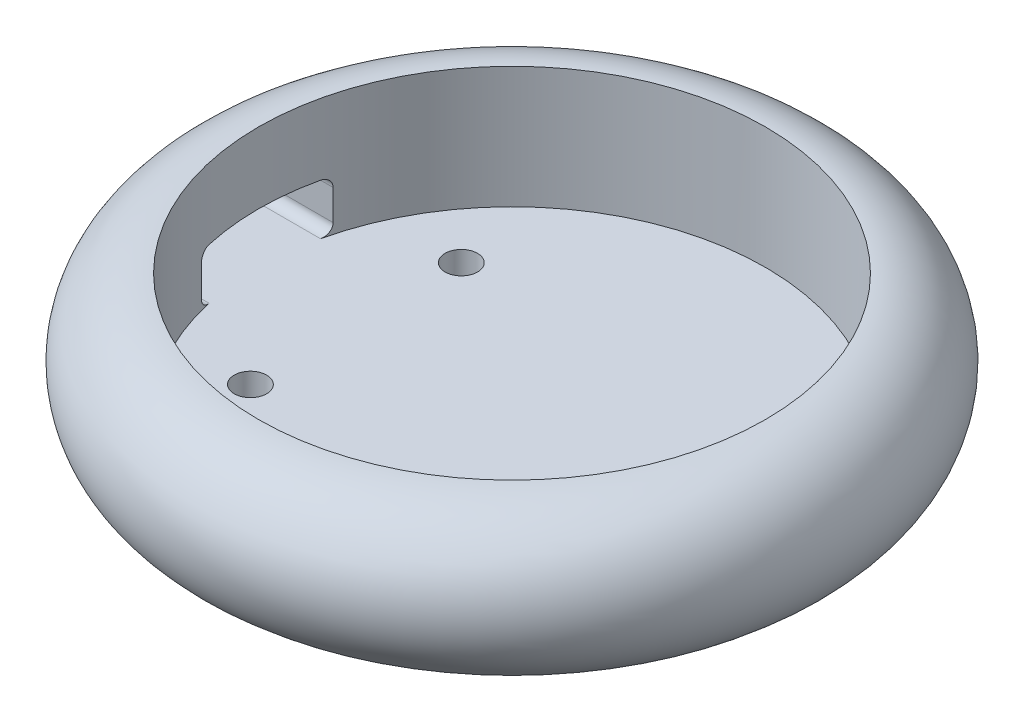
from build123d import *

# Parameters (mm, degrees)
SKETCH3_R          = 25
CUT_EXTRUDE2_DEPTH = 12
SKETCH4_R          = 1.6
CUT_EXTRUDE3_DEPTH = 6
SKETCH5_R          = 1.5
CUT_EXTRUDE4_DEPTH = 1
CUT_EXTRUDE6_DEPTH = 48.174881361


with BuildPart() as part:
    # Sketch1 → Revolve1 (revolve)
    with BuildSketch(Plane.XY):
        with BuildLine():
            Line((0, -4.371292721), (0, 10.628707279))
            Line((0, 10.628707279), (-25, 10.628707279))
            ThreePointArc((-25, 10.628707279), (-32.5, 3.128707279), (-25, -4.371292721))
            Line((-25, -4.371292721), (0, -4.371292721))
        make_face()
    revolve(axis=Axis((0, -4.371292721, 0), (0, 1, 0)))

    # Sketch3 → Cut-Extrude2 (cut)
    with BuildSketch(Plane(origin=(0, 10.628707279, 0), x_dir=(1, 0, 0), z_dir=(0, 1, 0))):
        Circle(SKETCH3_R)
    extrude(amount=-CUT_EXTRUDE2_DEPTH, mode=Mode.SUBTRACT)

    # Sketch4 → Cut-Extrude3 (cut)
    with BuildSketch(Plane(origin=(0, -1.371292721, 0), x_dir=(1, 0, 0), z_dir=(0, 1, 0))):
        with Locations((-15.4, 10.4)):
            Circle(SKETCH4_R)
        with Locations((15.4, 10.4)):
            Circle(SKETCH4_R)
        with Locations((15.4, -10.4)):
            Circle(SKETCH4_R)
        with Locations((-15.4, -10.4)):
            Circle(SKETCH4_R)
    extrude(amount=-CUT_EXTRUDE3_DEPTH, mode=Mode.SUBTRACT)

    # Sketch5 → Cut-Extrude4 (cut)
    with BuildSketch(Plane.XZ.offset(4.371292721)):
        Circle(SKETCH5_R)
    extrude(amount=-CUT_EXTRUDE4_DEPTH, mode=Mode.SUBTRACT)

    # Sketch8 → Cut-Extrude6 (cut, through all)
    with BuildSketch(Plane(origin=(0, 0, 0), x_dir=(0, 0, -1), z_dir=(1, 0, 0))):
        with BuildLine():
            Line((-5.5, 3.628707279), (5.5, 3.628707279))
            ThreePointArc((5.5, 3.628707279), (6.207106781, 3.33581406), (6.5, 2.628707279))
            Line((6.5, 2.628707279), (6.5, -0.371292721))
            ThreePointArc((6.5, -0.371292721), (6.207106781, -1.078399502), (5.5, -1.371292721))
            Line((5.5, -1.371292721), (-5.5, -1.371292721))
            ThreePointArc((-5.5, -1.371292721), (-6.207106781, -1.078399502), (-6.5, -0.371292721))
            Line((-6.5, -0.371292721), (-6.5, 2.628707279))
            ThreePointArc((-6.5, 2.628707279), (-6.207106781, 3.33581406), (-5.5, 3.628707279))
        make_face()
    extrude(amount=-CUT_EXTRUDE6_DEPTH, mode=Mode.SUBTRACT)


solid = part.part
